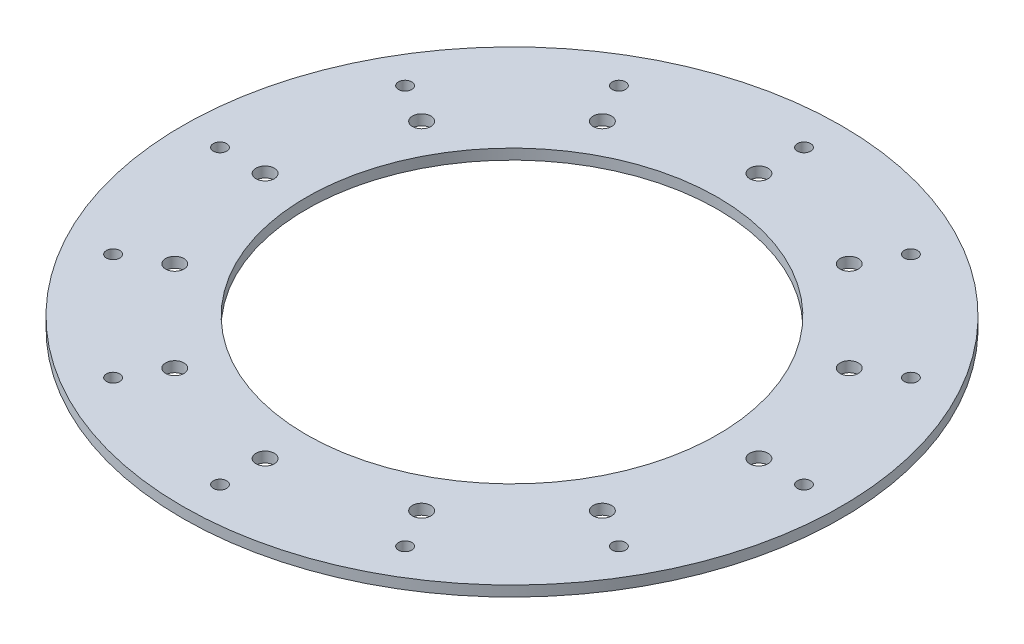
from build123d import *

# Parameters (mm, degrees)
SKETCH1_R           = 79
SKETCH1_R_2         = 49.3
BOSS_EXTRUDE1_DEPTH = 2.5
SKETCH2_R           = 1.6
CUT_EXTRUDE1_DEPTH  = 112.750838923
SKETCH3_R           = 2.2
CUT_EXTRUDE2_DEPTH  = 112.750838923


with BuildPart() as part:
    # Sketch1 → Boss-Extrude1 (new body)
    with BuildSketch(Plane(origin=(0, 0, 0), x_dir=(1, 0, 0), z_dir=(0, 1, 0))):
        Circle(SKETCH1_R)
        Circle(SKETCH1_R_2, mode=Mode.SUBTRACT)
    extrude(amount=BOSS_EXTRUDE1_DEPTH)

    # Sketch2 → Cut-Extrude1 (cut, through all)
    with BuildSketch(Plane(origin=(0, 2.5, 0), x_dir=(1, 0, 0), z_dir=(0, 1, 0))):
        with Locations((0, 70)):
            Circle(SKETCH2_R)
        with Locations((35, 60.621778265)):
            Circle(SKETCH2_R)
        with Locations((60.621778265, 35)):
            Circle(SKETCH2_R)
        with Locations((70, 0)):
            Circle(SKETCH2_R)
        with Locations((60.621778265, -35)):
            Circle(SKETCH2_R)
        with Locations((35, -60.621778265)):
            Circle(SKETCH2_R)
        with Locations((0, -70)):
            Circle(SKETCH2_R)
        with Locations((-35, -60.621778265)):
            Circle(SKETCH2_R)
        with Locations((-60.621778265, -35)):
            Circle(SKETCH2_R)
        with Locations((-70, 0)):
            Circle(SKETCH2_R)
        with Locations((-60.621778265, 35)):
            Circle(SKETCH2_R)
        with Locations((-35, 60.621778265)):
            Circle(SKETCH2_R)
    extrude(amount=-CUT_EXTRUDE1_DEPTH, mode=Mode.SUBTRACT)

    # Sketch3 → Cut-Extrude2 (cut, through all)
    with BuildSketch(Plane(origin=(0, 2.5, 0), x_dir=(1, 0, 0), z_dir=(0, 1, 0))):
        with Locations((0, 59.18)):
            Circle(SKETCH3_R)
        with Locations((29.59, 51.251383396)):
            Circle(SKETCH3_R)
        with Locations((51.251383396, 29.59)):
            Circle(SKETCH3_R)
        with Locations((59.18, 0)):
            Circle(SKETCH3_R)
        with Locations((51.251383396, -29.59)):
            Circle(SKETCH3_R)
        with Locations((29.59, -51.251383396)):
            Circle(SKETCH3_R)
        with Locations((0, -59.18)):
            Circle(SKETCH3_R)
        with Locations((-29.59, -51.251383396)):
            Circle(SKETCH3_R)
        with Locations((-51.251383396, -29.59)):
            Circle(SKETCH3_R)
        with Locations((-59.18, 0)):
            Circle(SKETCH3_R)
        with Locations((-51.251383396, 29.59)):
            Circle(SKETCH3_R)
        with Locations((-29.59, 51.251383396)):
            Circle(SKETCH3_R)
    extrude(amount=-CUT_EXTRUDE2_DEPTH, mode=Mode.SUBTRACT)


solid = part.part
